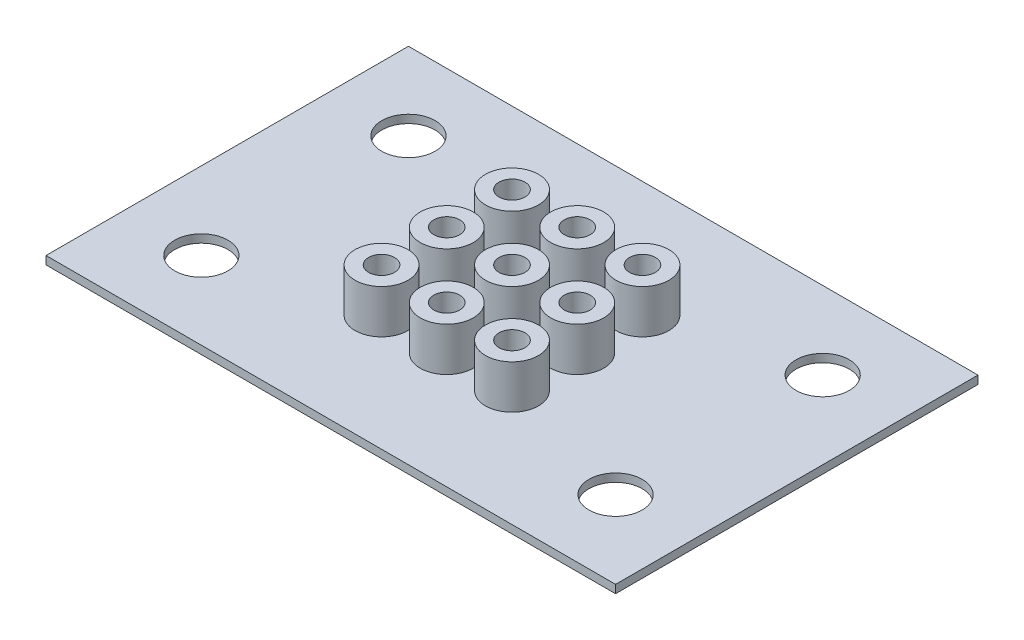
from build123d import *

# Parameters (mm, degrees)
SKETCH1_W           = 69.85
SKETCH1_H           = 44.45
SKETCH1_R           = 3.2639
SKETCH1_R_2         = 1.25
BOSS_EXTRUDE1_DEPTH = 1
SKETCH2_R           = 3.25
SKETCH2_R_2         = 1.59
BOSS_EXTRUDE2_DEPTH = 5.35


with BuildPart() as part:
    # Sketch1 → Boss-Extrude1 (new body)
    with BuildSketch(Plane(origin=(0, 0, 0), x_dir=(1, 0, 0), z_dir=(0, 1, 0))):
        with Locations((34.925, 22.225)):
            Rectangle(SKETCH1_W, SKETCH1_H)
        with Locations((9.525, 9.525)):
            Circle(SKETCH1_R, mode=Mode.SUBTRACT)
        with Locations((26.925, 14.225)):
            Circle(SKETCH1_R_2, mode=Mode.SUBTRACT)
        with Locations((26.925, 22.225)):
            Circle(SKETCH1_R_2, mode=Mode.SUBTRACT)
        with Locations((60.325, 9.525)):
            Circle(SKETCH1_R, mode=Mode.SUBTRACT)
        with Locations((34.925, 14.225)):
            Circle(SKETCH1_R_2, mode=Mode.SUBTRACT)
        with Locations((42.925, 14.225)):
            Circle(SKETCH1_R_2, mode=Mode.SUBTRACT)
        with Locations((26.925, 30.225)):
            Circle(SKETCH1_R_2, mode=Mode.SUBTRACT)
        with Locations((34.925, 30.225)):
            Circle(SKETCH1_R_2, mode=Mode.SUBTRACT)
        with Locations((9.525, 34.925)):
            Circle(SKETCH1_R, mode=Mode.SUBTRACT)
        with Locations((34.925, 22.225)):
            Circle(SKETCH1_R_2, mode=Mode.SUBTRACT)
        with Locations((42.925, 22.225)):
            Circle(SKETCH1_R_2, mode=Mode.SUBTRACT)
        with Locations((42.925, 30.225)):
            Circle(SKETCH1_R_2, mode=Mode.SUBTRACT)
        with Locations((60.325, 34.925)):
            Circle(SKETCH1_R, mode=Mode.SUBTRACT)
    extrude(amount=BOSS_EXTRUDE1_DEPTH)

    # Sketch2 → Boss-Extrude2 (add)
    # profile 1 of 9: a face of its own
    with BuildSketch(Plane(origin=(0, 1, 0), x_dir=(1, 0, 0), z_dir=(0, 1, 0))):
        with Locations((34.925, 22.225)):
            Circle(SKETCH2_R)
        with Locations((34.925, 22.225)):
            Circle(SKETCH2_R_2, mode=Mode.SUBTRACT)
    # profile 2 of 9: a face of its own
    with BuildSketch(Plane(origin=(0, 1, 0), x_dir=(1, 0, 0), z_dir=(0, 1, 0))):
        with Locations((42.925, 22.225)):
            Circle(SKETCH2_R)
        with Locations((42.925, 22.225)):
            Circle(SKETCH2_R_2, mode=Mode.SUBTRACT)
    # profile 3 of 9: a face of its own
    with BuildSketch(Plane(origin=(0, 1, 0), x_dir=(1, 0, 0), z_dir=(0, 1, 0))):
        with Locations((42.925, 30.225)):
            Circle(SKETCH2_R)
        with Locations((42.925, 30.225)):
            Circle(SKETCH2_R_2, mode=Mode.SUBTRACT)
    # profile 4 of 9: a face of its own
    with BuildSketch(Plane(origin=(0, 1, 0), x_dir=(1, 0, 0), z_dir=(0, 1, 0))):
        with Locations((34.925, 30.225)):
            Circle(SKETCH2_R)
        with Locations((34.925, 30.225)):
            Circle(SKETCH2_R_2, mode=Mode.SUBTRACT)
    # profile 5 of 9: a face of its own
    with BuildSketch(Plane(origin=(0, 1, 0), x_dir=(1, 0, 0), z_dir=(0, 1, 0))):
        with Locations((42.925, 14.225)):
            Circle(SKETCH2_R)
        with Locations((42.925, 14.225)):
            Circle(SKETCH2_R_2, mode=Mode.SUBTRACT)
    # profile 6 of 9: a face of its own
    with BuildSketch(Plane(origin=(0, 1, 0), x_dir=(1, 0, 0), z_dir=(0, 1, 0))):
        with Locations((34.925, 14.225)):
            Circle(SKETCH2_R)
        with Locations((34.925, 14.225)):
            Circle(SKETCH2_R_2, mode=Mode.SUBTRACT)
    # profile 7 of 9: a face of its own
    with BuildSketch(Plane(origin=(0, 1, 0), x_dir=(1, 0, 0), z_dir=(0, 1, 0))):
        with Locations((26.925, 22.225)):
            Circle(SKETCH2_R)
        with Locations((26.925, 22.225)):
            Circle(SKETCH2_R_2, mode=Mode.SUBTRACT)
    # profile 8 of 9: a face of its own
    with BuildSketch(Plane(origin=(0, 1, 0), x_dir=(1, 0, 0), z_dir=(0, 1, 0))):
        with Locations((26.925, 30.225)):
            Circle(SKETCH2_R)
        with Locations((26.925, 30.225)):
            Circle(SKETCH2_R_2, mode=Mode.SUBTRACT)
    # profile 9 of 9: a face of its own
    with BuildSketch(Plane(origin=(0, 1, 0), x_dir=(1, 0, 0), z_dir=(0, 1, 0))):
        with Locations((26.925, 14.225)):
            Circle(SKETCH2_R)
        with Locations((26.925, 14.225)):
            Circle(SKETCH2_R_2, mode=Mode.SUBTRACT)
    extrude(amount=BOSS_EXTRUDE2_DEPTH)


solid = part.part
